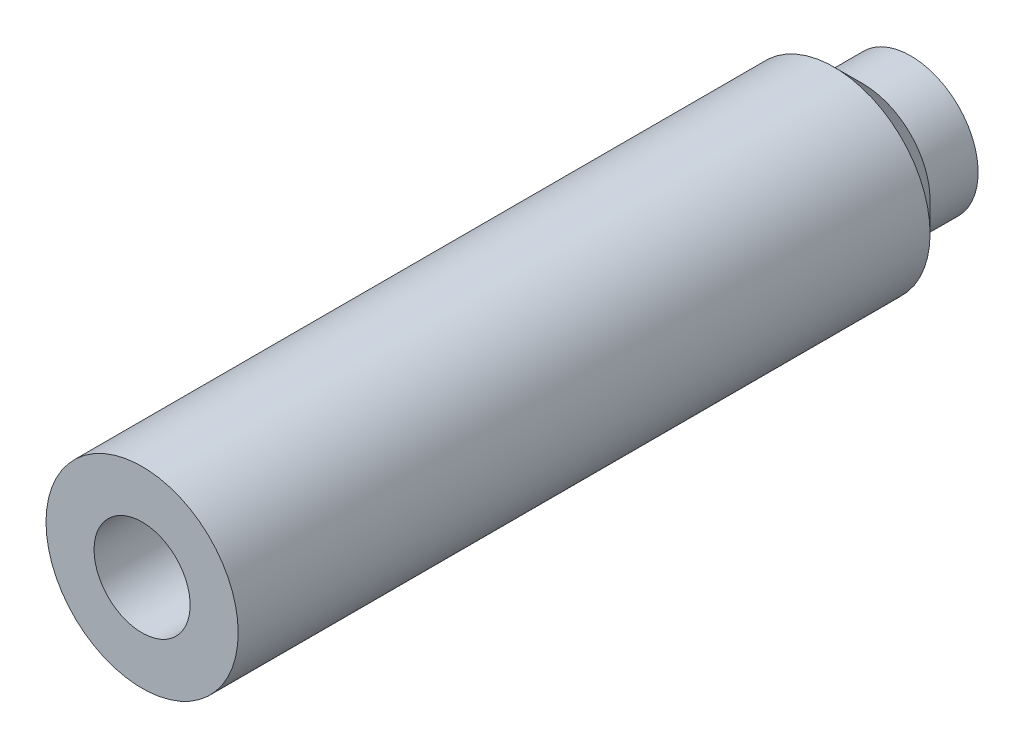
from build123d import *

# Parameters (mm, degrees)
SKETCH1_R           = 6.35
BOSS_EXTRUDE1_DEPTH = 50.8
SKETCH2_R           = 6.35
SKETCH2_R_2         = 4.445
CUT_EXTRUDE1_DEPTH  = 3.175
CHAMFER1_SIZE       = 1.905
SKETCH3_R           = 3.175
CUT_EXTRUDE2_DEPTH  = 52.587643869


with BuildPart() as part:
    # Sketch1 → Boss-Extrude1 (new body)
    with BuildSketch(Plane.XY):
        Circle(SKETCH1_R)
    extrude(amount=BOSS_EXTRUDE1_DEPTH)

    # Sketch2 → Cut-Extrude1 (cut)
    with BuildSketch(Plane(origin=(0, 0, 0), x_dir=(-1, 0, 0), z_dir=(0, 0, -1))):
        Circle(SKETCH2_R)
        Circle(SKETCH2_R_2, mode=Mode.SUBTRACT)
    extrude(amount=-CUT_EXTRUDE1_DEPTH, mode=Mode.SUBTRACT)

    # Chamfer1
    chamfer1_edges = [part.edges().sort_by_distance(p)[0] for p in [
        (-6.35, 0, 3.175),
    ]]
    chamfer(chamfer1_edges, length=CHAMFER1_SIZE - 0.0001)  # a hair under: the kernel refuses the full size

    # Sketch3 → Cut-Extrude2 (cut, through all)
    with BuildSketch(Plane(origin=(0, 0, 0), x_dir=(-1, 0, 0), z_dir=(0, 0, -1))):
        Circle(SKETCH3_R)
    extrude(amount=-CUT_EXTRUDE2_DEPTH, mode=Mode.SUBTRACT)


solid = part.part
